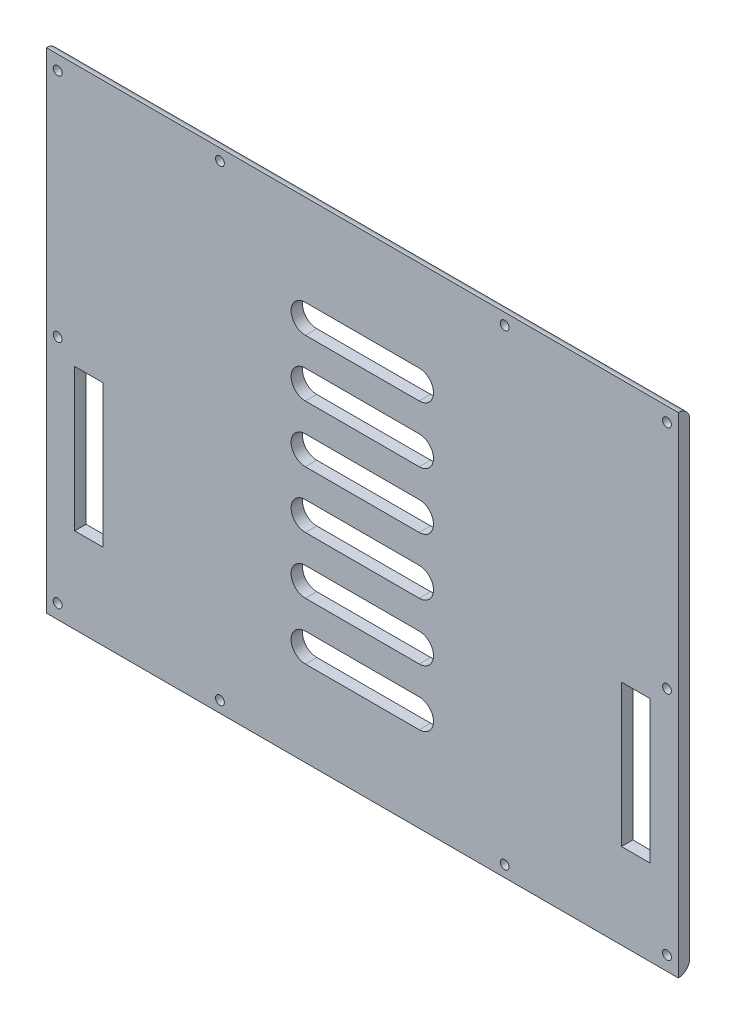
from build123d import *

# Parameters (mm, degrees)
SKETCH1_W           = 172
SKETCH1_H           = 222
SKETCH1_R           = 1.55
SKETCH1_W_2         = 50
SKETCH1_H_2         = 10
BOSS_EXTRUDE2_DEPTH = 4
FILLET1_R           = 4


with BuildPart() as part:
    # Sketch1 → Boss-Extrude2 (new body)
    with BuildSketch(Plane(origin=(0, 0, 0), x_dir=(0, 1, 0), z_dir=(0, 0, 1))):
        with Locations((86, 111)):
            Rectangle(SKETCH1_W, SKETCH1_H)
        with Locations(Location((5, 4, 0), (0, 0, 270))):
            Circle(SKETCH1_R, mode=Mode.SUBTRACT)
        with Locations(Location((5, 218, 0), (0, 0, 270))):
            Circle(SKETCH1_R, mode=Mode.SUBTRACT)
        with Locations(Location((167, 218, 0), (0, 0, 270))):
            Circle(SKETCH1_R, mode=Mode.SUBTRACT)
        with Locations(Location((167, 4, 0), (0, 0, 270))):
            Circle(SKETCH1_R, mode=Mode.SUBTRACT)
        with Locations(Location((86, 218, 0), (0, 0, 270))):
            Circle(SKETCH1_R, mode=Mode.SUBTRACT)
        with Locations(Location((86, 4, 0), (0, 0, 270))):
            Circle(SKETCH1_R, mode=Mode.SUBTRACT)
        with Locations(Location((4, 61, 0), (0, 0, 270))):
            Circle(SKETCH1_R, mode=Mode.SUBTRACT)
        with Locations(Location((168, 61, 0), (0, 0, 270))):
            Circle(SKETCH1_R, mode=Mode.SUBTRACT)
        with Locations(Location((168, 161, 0), (0, 0, 270))):
            Circle(SKETCH1_R, mode=Mode.SUBTRACT)
        with Locations(Location((4, 161, 0), (0, 0, 270))):
            Circle(SKETCH1_R, mode=Mode.SUBTRACT)
        with Locations((55, 207)):
            Rectangle(SKETCH1_W_2, SKETCH1_H_2, mode=Mode.SUBTRACT)
        with Locations((55, 15)):
            Rectangle(SKETCH1_W_2, SKETCH1_H_2, mode=Mode.SUBTRACT)
        with BuildLine():
            Line((40, 131), (40, 91))
            ThreePointArc((40, 91), (35, 86), (30, 91))
            Line((30, 91), (30, 131))
            ThreePointArc((30, 131), (35, 136), (40, 131))
        make_face(mode=Mode.SUBTRACT)
        with BuildLine():
            Line((60, 131), (60, 91))
            ThreePointArc((60, 91), (55, 86), (50, 91))
            Line((50, 91), (50, 131))
            ThreePointArc((50, 131), (55, 136), (60, 131))
        make_face(mode=Mode.SUBTRACT)
        with BuildLine():
            Line((80, 131), (80, 91))
            ThreePointArc((80, 91), (75, 86), (70, 91))
            Line((70, 91), (70, 131))
            ThreePointArc((70, 131), (75, 136), (80, 131))
        make_face(mode=Mode.SUBTRACT)
        with BuildLine():
            Line((100, 131), (100, 91))
            ThreePointArc((100, 91), (95, 86), (90, 91))
            Line((90, 91), (90, 131))
            ThreePointArc((90, 131), (95, 136), (100, 131))
        make_face(mode=Mode.SUBTRACT)
        with BuildLine():
            Line((120, 131), (120, 91))
            ThreePointArc((120, 91), (115, 86), (110, 91))
            Line((110, 91), (110, 131))
            ThreePointArc((110, 131), (115, 136), (120, 131))
        make_face(mode=Mode.SUBTRACT)
        with BuildLine():
            Line((140, 131), (140, 91))
            ThreePointArc((140, 91), (135, 86), (130, 91))
            Line((130, 91), (130, 131))
            ThreePointArc((130, 131), (135, 136), (140, 131))
        make_face(mode=Mode.SUBTRACT)
    extrude(amount=BOSS_EXTRUDE2_DEPTH)

    # Fillet1
    # the kernel refuses this fillet: 4 mm, written as the material it takes off along each edge
    with BuildSketch(Plane(origin=(10, 172, 0), x_dir=(0, 0, 1), z_dir=(-1, 0, 0)), Plane(origin=(-232, 0, 0), x_dir=(0, 0, 1), z_dir=(1, 0, 0))) as fillet1_piece_1:
        with BuildLine():
            CenterArc((FILLET1_R, -FILLET1_R), FILLET1_R, 90, 90)
            Line((0, -FILLET1_R), (0, 0))
            Line((0, 0), (FILLET1_R, 0))
        make_face()
    extrude(amount=242, mode=Mode.SUBTRACT)


solid = part.part
